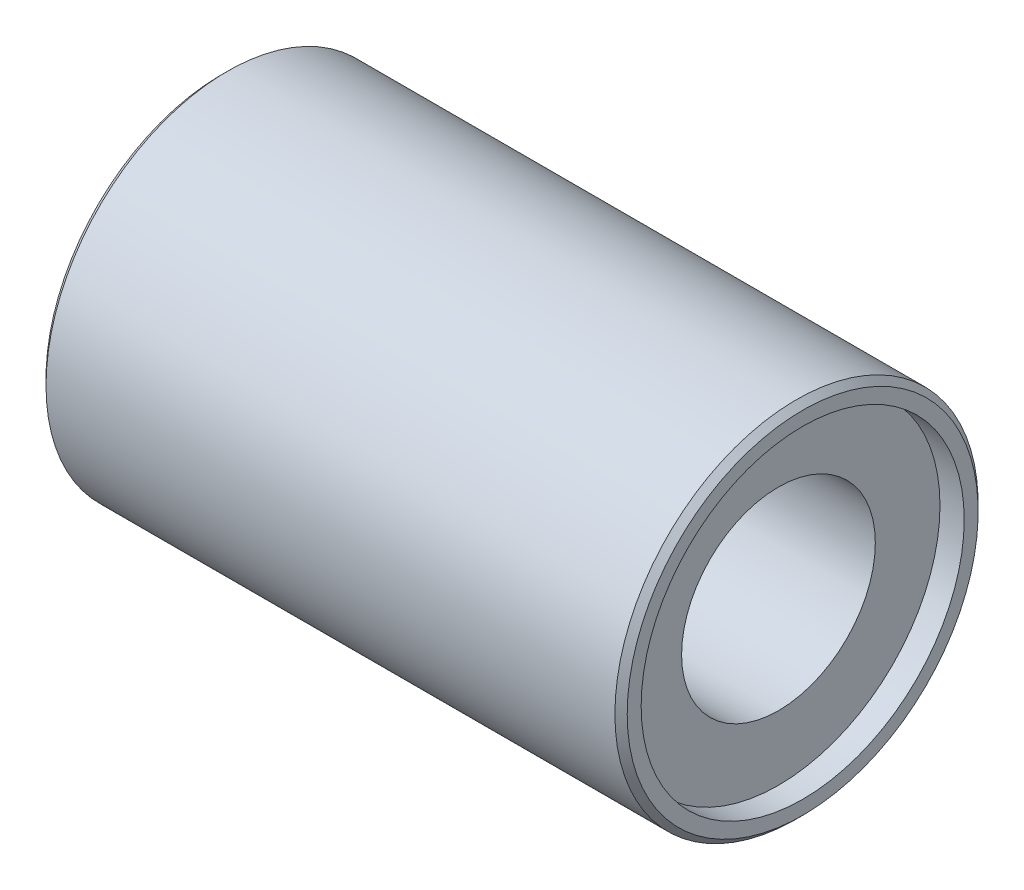
from build123d import *

# Parameters (mm, degrees)
CHAMFER1_SIZE = 0.254


with BuildPart() as part:
    # Sketch3 → Revolve1 (revolve)
    with BuildSketch(Plane.XY):
        Polygon((1, 4), (23, 4), (23, 6.67), (24, 6.67), (24, 7.5), (0, 7.5), (0, 6.67), (1, 6.67), align=None)
    revolve(axis=Axis((0, 0, 0), (1, 0, 0)))

    # Chamfer1
    chamfer1_edges = [part.edges().sort_by_distance(p)[0] for p in [
        (0, -7.5, 0),
        (24, -7.5, 0),
    ]]
    chamfer(chamfer1_edges, length=CHAMFER1_SIZE)


solid = part.part
